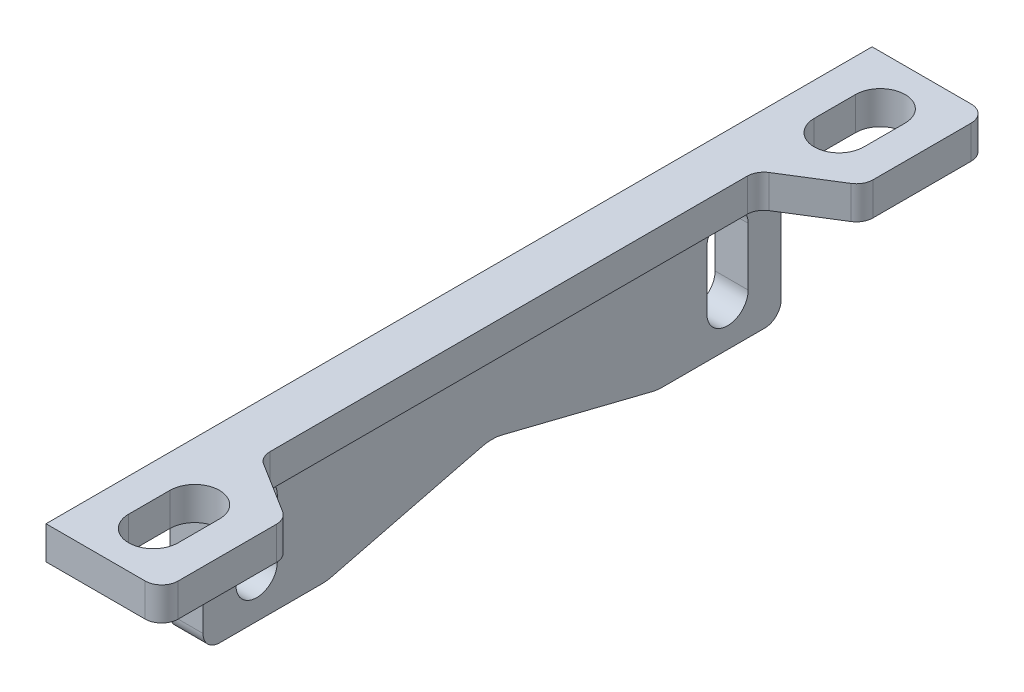
from build123d import *

# Parameters (mm, degrees)
TOP_DEPTH             = 5.08
SKETCH2_W             = 5.08
SKETCH2_H             = 44.45
BOLT_ATTACH_DEPTH     = 19.05
BOLTHOLES_LOWER_DEPTH = 5.08
MIRROREDFILLET_R      = 2.54
CENTERFILLET_R        = 6.35
CHAMFER1_SIZE         = 2.54


with BuildPart() as part:
    # Sketch1 → top (new body)
    with BuildSketch(Plane(origin=(0, 0, 0), x_dir=(1, 0, 0), z_dir=(0, 1, 0))):
        Polygon((0, 0), (0, 63.5), (7.62, 63.5), (7.62, 25.4), (17.78, 19.05), (17.78, 0), align=None)
        with BuildLine():
            Line((12.7, 13.97), (12.7, 7.62))
            ThreePointArc((12.7, 7.62), (8.89, 3.81), (5.08, 7.62))
            Line((5.08, 7.62), (5.08, 13.97))
            ThreePointArc((5.08, 13.97), (8.89, 17.78), (12.7, 13.97))
        make_face(mode=Mode.SUBTRACT)
    extrude(amount=TOP_DEPTH)

    # Sketch2 → bolt_attach (add)
    with BuildSketch(Plane.XZ):
        with Locations((2.54, -41.275)):
            Rectangle(SKETCH2_W, SKETCH2_H)
    extrude(amount=BOLT_ATTACH_DEPTH)

    # Sketch3 → boltholes_lower (cut)
    with BuildSketch(Plane(origin=(5.08, 0, 0), x_dir=(0, 0, -1), z_dir=(1, 0, 0))):
        with BuildLine():
            Line((30.48, -3.81), (30.48, -12.7))
            ThreePointArc((30.48, -12.7), (27.305, -15.875), (24.13, -12.7))
            Line((24.13, -12.7), (24.13, -3.81))
            ThreePointArc((24.13, -3.81), (27.305, -0.635), (30.48, -3.81))
        make_face()
        Polygon((63.5, -19.05), (63.5, -12.7), (38.1, -19.05), align=None)
    extrude(amount=-BOLTHOLES_LOWER_DEPTH, mode=Mode.SUBTRACT)

    # mirroredfillet
    mirroredfillet_edges = [part.edges().sort_by_distance(p)[0] for p in [
        (7.62, 2.54, -25.4),
        (17.78, 2.54, -19.05),
        (17.78, 2.54, 0),
        (2.54, -19.05, -19.05),
    ]]
    fillet(mirroredfillet_edges, radius=MIRROREDFILLET_R)

    # Mirror2: part across face


with BuildPart() as part_1:
    add(part.part)
    add(part.part.mirror(Plane(origin=(3.01625, -3.01625, -63.5), x_dir=(1, 0, 0), z_dir=(0, 0, -1))))

    # centerfillet
    centerfillet_edges = [part_1.edges().sort_by_distance(p)[0] for p in [
        (2.54, -12.7, -63.5),
        (2.54, -19.05, -88.9),
        (2.54, -19.05, -38.1),
    ]]
    fillet(centerfillet_edges, radius=CENTERFILLET_R)

    # Chamfer1
    # the kernel refuses this chamfer: 2.54 mm, written as the material it adds along each edge
    with BuildSketch(Plane(origin=(5.08, 0, -19.05), x_dir=(0.9996219169112968, 0.02749587661058638, 0), z_dir=(0, 0, -1))) as chamfer1_piece_1_section:
        Polygon((CHAMFER1_SIZE * 0.999621916911, CHAMFER1_SIZE * 0.0274958766106), (-CHAMFER1_SIZE * 0.0274958766106, CHAMFER1_SIZE * 0.999621916911), (0, 0), align=None)
    chamfer1_piece_1 = extrude(amount=88.9, mode=Mode.PRIVATE)
    chamfer1_piece_1 = chamfer1_piece_1 - Plane(origin=(5.940102797, -3.81, -27.305), x_dir=(0, 0, 1), z_dir=(1, 0, 0)) * Cylinder(3.175, 188, mode=Mode.PRIVATE)
    chamfer1_piece_1 = chamfer1_piece_1 - Plane(origin=(5.940102797, -3.81, -99.695), x_dir=(0, 0, -1), z_dir=(1, 0, 0)) * Cylinder(3.175, 188, mode=Mode.PRIVATE)
    add(chamfer1_piece_1)


solid = part_1.part
